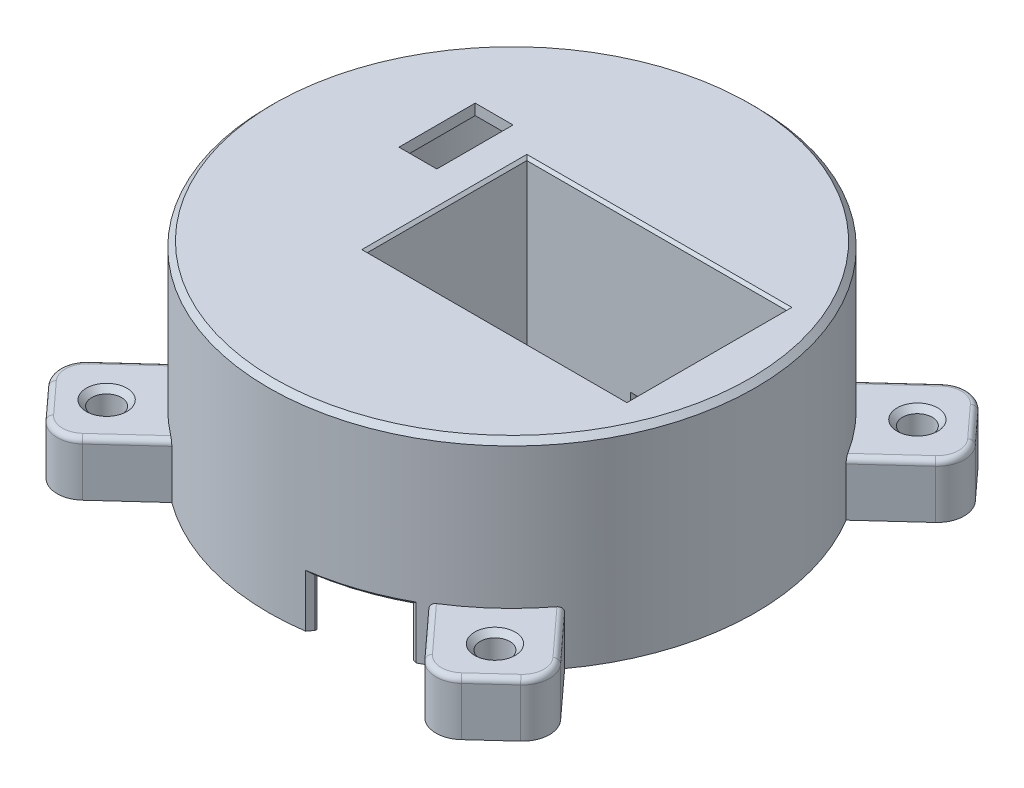
from build123d import *

# Parameters (mm, degrees)
SKETCH3_R                 = 45
BOSS_EXTRUDE1_DEPTH       = 37
SKETCH25_W                = 48
SKETCH25_H                = 29.5
CUT_EXTRUDE14_DEPTH       = 34
CUT_EXTRUDE19_DEPTH       = 73.15261603
CUT_EXTRUDE19_DEPTH_BACK  = 73.15261603
SKETCH30_R                = 1.546966385
SKETCH30_R_2              = 1.5
SKETCH42_R                = 2.75
BOSS_EXTRUDE2_DEPTH       = 10
CUT_EXTRUDE27_DEPTH       = 91.916966477
CUT_EXTRUDE27_DEPTH_BACK  = 91.916966477
SHELL3_OUTLINE_R          = 43
SHELL3_OUTLINE_W          = 52
SHELL3_OUTLINE_H          = 33.5
SHELL3_DEPTH              = 35
SHELL3_2_OUTLINE_R        = 4.75
SHELL3_2_DEPTH            = 8
SHELL3_3_OUTLINE_W        = 16.95
SHELL3_3_OUTLINE_H        = 33.5
SHELL3_3_OUTLINE_R        = 3.5
SHELL3_3_OUTLINE_W_2      = 21.15
SHELL3_3_OUTLINE_R_2      = 3.546966385
SHELL3_3_DEPTH            = 1
FILLET14_R                = 1
CUT_EXTRUDE28_OUTLINE_R   = 3.546966385
CUT_EXTRUDE28_OUTLINE_R_2 = 1.546966385
CUT_EXTRUDE28_DEPTH       = 1
CHAMFER13_START           = -1
CHAMFER13_DEPTH           = 10.7500001
FILLET18_R                = 1
FILLET20_R                = 5
FILLET21_R                = 1
CHAMFER14_SIZE            = 1
FILLET22_R                = 1
CHAMFER15_SIZE            = 0.5
SKETCH46_R                = 1.546966385
SKETCH46_R_2              = 1.5
BOSS_EXTRUDE4_DEPTH       = 1
CHAMFER16_SIZE            = 1.5
CHAMFER17_SIZE            = 1
FILLET23_R                = 1
CUT_EXTRUDE29_DEPTH       = 79.330854224
CUT_EXTRUDE29_DEPTH_BACK  = 79.330854224


with BuildPart() as part:
    # Sketch3 → Boss-Extrude1 (new body)
    with BuildSketch(Plane(origin=(0, 0, 0), x_dir=(1, 0, 0), z_dir=(0, 1, 0))):
        with Locations(Location((0, 0, 0), (0, 0, 270))):
            Circle(SKETCH3_R)
    extrude(amount=BOSS_EXTRUDE1_DEPTH)

    # Sketch25 → Cut-Extrude14 (cut)
    with BuildSketch(Plane(origin=(0, 37, 0), x_dir=(1, 0, 0), z_dir=(0, 1, 0))):
        with Locations((11.99, 0)):
            Rectangle(SKETCH25_W, SKETCH25_H)
    extrude(amount=-CUT_EXTRUDE14_DEPTH, mode=Mode.SUBTRACT)

    # Sketch30 → Cut-Extrude19 (cut, two sides: drawn at the far end of the back side and taken through both)
    with BuildSketch(Plane(origin=(0, 3, 0), x_dir=(1, 0, 0), z_dir=(0, 1, 0)).offset(-CUT_EXTRUDE19_DEPTH_BACK)):
        with Locations(Location((-7.56, 11, 0), (0, 0, 270))):
            Circle(SKETCH30_R)
        with Locations(Location((-7.56, -11, 0), (0, 0, 270))):
            Circle(SKETCH30_R)
        with Locations(Location((32.44, 11, 0), (0, 0, 270))):
            Circle(SKETCH30_R_2)
        with Locations(Location((32.44, -11, 0), (0, 0, 270))):
            Circle(SKETCH30_R_2)
    extrude(amount=CUT_EXTRUDE19_DEPTH + CUT_EXTRUDE19_DEPTH_BACK, mode=Mode.SUBTRACT)

    # Sketch42 → Boss-Extrude2 (add)
    # profile 1 of 4: a face of its own
    with BuildSketch(Plane.XZ):
        with BuildLine():
            Line((38.899023981, -47.567400455), (50.883533896, -34.447897338))
            Line((50.883533896, -34.447897338), (38.562739087, -23.192997955))
            ThreePointArc((38.562739087, -23.192997955), (33.22449062, -30.350176656), (26.578229172, -36.312501072))
            Line((26.578229172, -36.312501072), (38.899023981, -47.567400455))
        make_face()
        with Locations(Location((39.047557852, -35.89260325, 0), (0, 0, 270))):
            Circle(SKETCH42_R, mode=Mode.SUBTRACT)
    # profile 2 of 4: a face of its own
    with BuildSketch(Plane.XZ):
        with BuildLine():
            Line((-34.447897338, -50.883533896), (-23.192997955, -38.562739087))
            ThreePointArc((-23.192997955, -38.562739087), (-30.350176656, -33.22449062), (-36.312501072, -26.578229172))
            Line((-36.312501072, -26.578229172), (-47.567400455, -38.899023981))
            Line((-47.567400455, -38.899023981), (-34.447897338, -50.883533896))
        make_face()
        with Locations(Location((-35.89260325, -39.047557852, 0), (0, 0, 270))):
            Circle(SKETCH42_R, mode=Mode.SUBTRACT)
    # profile 3 of 4: a face of its own
    with BuildSketch(Plane.XZ):
        with BuildLine():
            ThreePointArc((23.192997955, 38.562739087), (30.350176656, 33.22449062), (36.312501072, 26.578229172))
            Line((36.312501072, 26.578229172), (47.567400455, 38.899023981))
            Line((47.567400455, 38.899023981), (34.447897338, 50.883533896))
            Line((34.447897338, 50.883533896), (23.192997955, 38.562739087))
        make_face()
        with Locations(Location((35.89260325, 39.047557852, 0), (0, 0, 270))):
            Circle(SKETCH42_R, mode=Mode.SUBTRACT)
    # profile 4 of 4: a face of its own
    with BuildSketch(Plane.XZ):
        with BuildLine():
            Line((-50.883533896, 34.447897338), (-38.562739087, 23.192997955))
            ThreePointArc((-38.562739087, 23.192997955), (-33.22449062, 30.350176656), (-26.578229172, 36.312501072))
            Line((-26.578229172, 36.312501072), (-38.899023981, 47.567400455))
            Line((-38.899023981, 47.567400455), (-50.883533896, 34.447897338))
        make_face()
        with Locations(Location((-39.047557852, 35.89260325, 0), (0, 0, 270))):
            Circle(SKETCH42_R, mode=Mode.SUBTRACT)
    extrude(amount=-BOSS_EXTRUDE2_DEPTH)

    # Sketch26 → Cut-Extrude27 (cut, two sides: drawn at the far end of the back side and taken through both)
    with BuildSketch(Plane.XY.offset(-14.75).offset(-CUT_EXTRUDE27_DEPTH_BACK)):
        Polygon((7.14, 3), (7.14, 9), (21.04, 9), (21.04, 3), (21.04, -1.446345943), (7.14, -1.446345943), align=None)
    extrude(amount=CUT_EXTRUDE27_DEPTH + CUT_EXTRUDE27_DEPTH_BACK, mode=Mode.SUBTRACT)

    # Shell3: read off the stored shape, not the designer's step
    # Shell3 outline → Shell3 (cut)
    with BuildSketch(Plane(origin=(0, 0, 0), x_dir=(1, 0, 0), z_dir=(0, 1, 0))):
        Circle(SHELL3_OUTLINE_R)
        with Locations((11.99, 0)):
            Rectangle(SHELL3_OUTLINE_W, SHELL3_OUTLINE_H, mode=Mode.SUBTRACT)
    extrude(amount=SHELL3_DEPTH, mode=Mode.SUBTRACT)

    # Shell3 2 outline → Shell3 2 (cut)
    # profile 1 of 4: a face of its own
    with BuildSketch(Plane(origin=(0, 0, 0), x_dir=(1, 0, 0), z_dir=(0, 1, 0))):
        with BuildLine():
            ThreePointArc((26.694921587, 33.710253062), (31.747846592, 29.001279916), (35.981638021, 23.544038))
            Line((35.981638021, 23.544038), (48.057993128, 34.575644626))
            Line((48.057993128, 34.575644626), (38.771276694, 44.741859688))
            Line((38.771276694, 44.741859688), (26.694921587, 33.710253062))
        make_face()
        with Locations((39.047557852, 35.89260325)):
            Circle(SHELL3_2_OUTLINE_R, mode=Mode.SUBTRACT)
    # profile 2 of 4: a face of its own
    with BuildSketch(Plane(origin=(0, 0, 0), x_dir=(1, 0, 0), z_dir=(0, 1, 0))):
        with BuildLine():
            Line((44.741859688, -38.771276694), (33.710253062, -26.694921587))
            ThreePointArc((33.710253062, -26.694921587), (29.001279916, -31.747846592), (23.544038, -35.981638021))
            Line((23.544038, -35.981638021), (34.575644626, -48.057993128))
            Line((34.575644626, -48.057993128), (44.741859688, -38.771276694))
        make_face()
        with Locations((35.89260325, -39.047557852)):
            Circle(SHELL3_2_OUTLINE_R, mode=Mode.SUBTRACT)
    # profile 3 of 4: a face of its own
    with BuildSketch(Plane(origin=(0, 0, 0), x_dir=(1, 0, 0), z_dir=(0, 1, 0))):
        with BuildLine():
            ThreePointArc((-33.710253062, 26.694921587), (-29.001279916, 31.747846592), (-23.544038, 35.981638021))
            Line((-23.544038, 35.981638021), (-34.575644626, 48.057993128))
            Line((-34.575644626, 48.057993128), (-44.741859688, 38.771276694))
            Line((-44.741859688, 38.771276694), (-33.710253062, 26.694921587))
        make_face()
        with Locations((-35.89260325, 39.047557852)):
            Circle(SHELL3_2_OUTLINE_R, mode=Mode.SUBTRACT)
    # profile 4 of 4: a face of its own
    with BuildSketch(Plane(origin=(0, 0, 0), x_dir=(1, 0, 0), z_dir=(0, 1, 0))):
        with BuildLine():
            Line((-38.771276694, -44.741859688), (-26.694921587, -33.710253062))
            ThreePointArc((-26.694921587, -33.710253062), (-31.747846592, -29.001279916), (-35.981638021, -23.544038))
            Line((-35.981638021, -23.544038), (-48.057993128, -34.575644626))
            Line((-48.057993128, -34.575644626), (-38.771276694, -44.741859688))
        make_face()
        with Locations((-39.047557852, -35.89260325)):
            Circle(SHELL3_2_OUTLINE_R, mode=Mode.SUBTRACT)
    extrude(amount=SHELL3_2_DEPTH, mode=Mode.SUBTRACT)

    # Shell3 3 outline → Shell3 3 (cut)
    # profile 1 of 2: a face of its own
    with BuildSketch(Plane(origin=(0, 0, 0), x_dir=(1, 0, 0), z_dir=(0, 1, 0))):
        with Locations((29.515, 0)):
            Rectangle(SHELL3_3_OUTLINE_W, SHELL3_3_OUTLINE_H)
        with Locations((32.44, -11)):
            Circle(SHELL3_3_OUTLINE_R, mode=Mode.SUBTRACT)
        with Locations((32.44, 11)):
            Circle(SHELL3_3_OUTLINE_R, mode=Mode.SUBTRACT)
    # profile 2 of 2: a face of its own
    with BuildSketch(Plane(origin=(0, 0, 0), x_dir=(1, 0, 0), z_dir=(0, 1, 0))):
        with Locations((-3.435, 0)):
            Rectangle(SHELL3_3_OUTLINE_W_2, SHELL3_3_OUTLINE_H)
        with Locations((-7.56, -11)):
            Circle(SHELL3_3_OUTLINE_R_2, mode=Mode.SUBTRACT)
        with Locations((-7.56, 11)):
            Circle(SHELL3_3_OUTLINE_R_2, mode=Mode.SUBTRACT)
    extrude(amount=SHELL3_3_DEPTH, mode=Mode.SUBTRACT)

    # Fillet14
    fillet14_edges = [part.edges().sort_by_distance(p)[0] for p in [
        (37.99, 18, -16.75),
        (11.99, 35, -16.75),
        (-14.01, 18, 16.75),
        (11.99, 35, 16.75),
        (37.99, 35, 0),
        (37.99, 18, 16.75),
        (-14.01, 35, 0),
        (-14.01, 18, -16.75),
        (14.09, 9, 16.75),
        (14.09, 9, -16.75),
        (21.04, 5, 16.75),
        (21.04, 5, -16.75),
        (7.14, 5, -16.75),
        (7.14, 5, 16.75),
    ]]
    fillet(fillet14_edges, radius=FILLET14_R)

    # Cut-Extrude28: read off the stored shape, not the designer's step
    # Cut-Extrude28 outline → Cut-Extrude28 (cut)
    # profile 1 of 2: a face of its own
    with BuildSketch(Plane.XZ.offset(-1)):
        with Locations((-7.56, -11)):
            Circle(CUT_EXTRUDE28_OUTLINE_R)
        with Locations((-7.56, -11)):
            Circle(CUT_EXTRUDE28_OUTLINE_R_2, mode=Mode.SUBTRACT)
    # profile 2 of 2: a face of its own
    with BuildSketch(Plane.XZ.offset(-1)):
        with Locations((-7.56, 11)):
            Circle(CUT_EXTRUDE28_OUTLINE_R)
        with Locations((-7.56, 11)):
            Circle(CUT_EXTRUDE28_OUTLINE_R_2, mode=Mode.SUBTRACT)
    extrude(amount=CUT_EXTRUDE28_DEPTH, mode=Mode.SUBTRACT)

    # Chamfer13: read off the stored shape, not the designer's step
    # Chamfer13 outline → Chamfer13 (cut)
    with BuildSketch(Plane(origin=(0, 0, 0), x_dir=(1, 0, 0), z_dir=(0, 1, 0)).offset(CHAMFER13_START)):
        with BuildLine():
            Line((6.493764385, -42.506835028), (7.14, -43.153070644))
            Line((7.14, -43.153070644), (7.14, -43.524879746))
            Line((7.14, -43.524879746), (6.404595784, -44.541903337))
            ThreePointArc((6.404595784, -44.541903337), (14.280665495, -42.67390998), (21.69466313, -39.425139083))
            Line((21.69466313, -39.425139083), (21.04, -39.223434924))
            Line((21.04, -39.223434924), (21.04, -38.250911989))
            Line((21.04, -38.250911989), (22.889204158, -36.401707831))
            ThreePointArc((22.889204158, -36.401707831), (15.005260898, -40.296924763), (6.493764385, -42.506835028))
        make_face()
        with BuildLine():
            Line((7.14, 43.153070644), (6.493764385, 42.506835028))
            ThreePointArc((6.493764385, 42.506835028), (15.005260898, 40.296924763), (22.889204158, 36.401707831))
            Line((22.889204158, 36.401707831), (21.04, 38.250911989))
            Line((21.04, 38.250911989), (21.04, 39.223434924))
            Line((21.04, 39.223434924), (21.69466313, 39.425139083))
            ThreePointArc((21.69466313, 39.425139083), (14.280665495, 42.67390998), (6.404595784, 44.541903337))
            Line((6.404595784, 44.541903337), (7.14, 43.524879746))
            Line((7.14, 43.524879746), (7.14, 43.153070644))
        make_face()
    extrude(amount=CHAMFER13_DEPTH, mode=Mode.SUBTRACT)

    # Chamfer13 2 outline → Chamfer13 2 (revolve)
    with BuildSketch(Plane.XY):
        Polygon((43, 9.75), (43.75, 9), (44.25, 9), (45, 9.75), align=None)
    revolve(axis=Axis((0, 0, 0), (0, 1, 0)))

    # Fillet18
    fillet18_edges = [part.edges().sort_by_distance(p)[0] for p in [
        (7.14, 3, 0),
        (21.04, 3, 0),
    ]]
    fillet(fillet18_edges, radius=FILLET18_R)

    # Fillet20
    fillet20_edges = [part.edges().sort_by_distance(p)[0] for p in [
        (38.899023981, 5, -47.567400455),
        (50.883533896, 5, -34.447897338),
        (34.447897338, 5, 50.883533896),
        (47.567400455, 5, 38.899023981),
        (-50.883533896, 5, 34.447897338),
        (-38.899023981, 5, 47.567400455),
        (-34.447897338, 5, -50.883533896),
        (-47.567400455, 5, -38.899023981),
    ]]
    fillet(fillet20_edges, radius=FILLET20_R)

    # Fillet21
    fillet21_edges = [part.edges().sort_by_distance(p)[0] for p in [
        (40.253829838, 10, 30.892821542),
        (41.007648897, 10, 44.891278938),
        (27.134326721, 10, 42.877331457),
        (34.541438124, 10, 48.81457957),
        (45.49844613, 10, 38.805483195),
        (-30.892821542, 10, 40.253829838),
        (-44.891278938, 10, 41.007648897),
        (-42.877331457, 10, 27.134326721),
        (-48.81457957, 10, 34.541438124),
        (-38.805483195, 10, 45.49844613),
        (-40.253829838, 10, -30.892821542),
        (-41.007648897, 10, -44.891278938),
        (-27.134326721, 10, -42.877331457),
        (-34.541438124, 10, -48.81457957),
        (-45.49844613, 10, -38.805483195),
        (44.891278938, 10, -41.007648897),
        (42.877331457, 10, -27.134326721),
        (30.892821542, 10, -40.253829838),
        (38.805483195, 10, -45.49844613),
        (48.81457957, 10, -34.541438124),
    ]]
    fillet(fillet21_edges, radius=FILLET21_R)

    # Chamfer14
    chamfer14_edges = [part.edges().sort_by_distance(p)[0] for p in [
        (39.047557852, 10, -33.14260325),
        (35.89260325, 10, 41.797557852),
        (-39.047557852, 10, 38.64260325),
        (-35.89260325, 10, -36.297557852),
    ]]
    chamfer(chamfer14_edges, length=CHAMFER14_SIZE)

    # Fillet22
    fillet22_edges = [part.edges().sort_by_distance(p)[0] for p in [
        (31.747846592, 8, -29.001279916),
        (29.001279916, 8, 31.747846592),
        (-31.747846592, 8, 29.001279916),
        (-29.001279916, 8, -31.747846592),
    ]]
    fillet(fillet22_edges, radius=FILLET22_R)

    # Chamfer15
    chamfer15_edges = [part.edges().sort_by_distance(p)[0] for p in [
        (11.99, 37, 14.75),
        (35.99, 37, 0),
        (11.99, 37, -14.75),
        (-12.01, 37, 0),
    ]]
    chamfer(chamfer15_edges, length=CHAMFER15_SIZE)

    # Sketch46 → Boss-Extrude4 (add)
    # profile 1 of 2: a face of its own
    with BuildSketch(Plane.XZ.offset(-1)):
        with BuildLine():
            Line((-13.01, -16.75), (6.14, -16.75))
            ThreePointArc((6.14, -16.75), (6.847106781, -16.457106781), (7.14, -15.75))
            Line((7.14, -15.75), (7.14, 15.75))
            ThreePointArc((7.14, 15.75), (6.847106781, 16.457106781), (6.14, 16.75))
            Line((6.14, 16.75), (-13.01, 16.75))
            ThreePointArc((-13.01, 16.75), (-13.717106781, 16.457106781), (-14.01, 15.75))
            Line((-14.01, 15.75), (-14.01, -15.75))
            ThreePointArc((-14.01, -15.75), (-13.717106781, -16.457106781), (-13.01, -16.75))
        make_face()
        with Locations(Location((-7.56, 11, 0), (0, 0, 90))):
            Circle(SKETCH46_R, mode=Mode.SUBTRACT)
        with Locations(Location((-7.56, -11, 0), (0, 0, 90))):
            Circle(SKETCH46_R, mode=Mode.SUBTRACT)
    # profile 2 of 2: a face of its own
    with BuildSketch(Plane.XZ.offset(-1)):
        with BuildLine():
            Line((21.04, 15.75), (21.04, -15.75))
            ThreePointArc((21.04, -15.75), (21.332893219, -16.457106781), (22.04, -16.75))
            Line((22.04, -16.75), (36.99, -16.75))
            ThreePointArc((36.99, -16.75), (37.697106781, -16.457106781), (37.99, -15.75))
            Line((37.99, -15.75), (37.99, 15.75))
            ThreePointArc((37.99, 15.75), (37.697106781, 16.457106781), (36.99, 16.75))
            Line((36.99, 16.75), (22.04, 16.75))
            ThreePointArc((22.04, 16.75), (21.332893219, 16.457106781), (21.04, 15.75))
        make_face()
        with Locations(Location((32.44, 11, 0), (0, 0, 90))):
            Circle(SKETCH46_R_2, mode=Mode.SUBTRACT)
        with Locations(Location((32.44, -11, 0), (0, 0, 90))):
            Circle(SKETCH46_R_2, mode=Mode.SUBTRACT)
    extrude(amount=BOSS_EXTRUDE4_DEPTH)

    # Chamfer16
    chamfer16_edges = [part.edges().sort_by_distance(p)[0] for p in [
        (32.44, 0, 9.5),
        (32.44, 0, -12.5),
        (-7.56, 0, 9.453033615),
        (-7.56, 0, -12.546966385),
    ]]
    chamfer(chamfer16_edges, length=CHAMFER16_SIZE)

    # Chamfer17
    chamfer17_edges = [part.edges().sort_by_distance(p)[0] for p in [
        (0, 37, -45),
    ]]
    chamfer(chamfer17_edges, length=CHAMFER17_SIZE)

    # Fillet23
    fillet23_edges = [part.edges().sort_by_distance(p)[0] for p in [
        (-13.717106781, 0, -16.457106781),
        (-3.435, 0, -16.75),
        (6.847106781, 0, -16.457106781),
        (7.14, 0, 0),
        (6.847106781, 0, 16.457106781),
        (-3.435, 0, 16.75),
        (-13.717106781, 0, 16.457106781),
        (-14.01, 0, 0),
        (21.332893219, 0, 16.457106781),
        (21.04, 0, 0),
        (21.332893219, 0, -16.457106781),
        (29.515, 0, -16.75),
        (37.697106781, 0, -16.457106781),
        (37.99, 0, 0),
        (37.697106781, 0, 16.457106781),
        (29.515, 0, 16.75),
    ]]
    fillet(fillet23_edges, radius=FILLET23_R)

    # Sketch47 → Cut-Extrude29 (cut, two sides: drawn at the far end of the back side and taken through both)
    with BuildSketch(Plane(origin=(0, 37, 0), x_dir=(1, 0, 0), z_dir=(0, 1, 0)).offset(-CUT_EXTRUDE29_DEPTH_BACK)):
        Polygon((-25.48586, 11.635201679), (-25.48586, 4.585201679), (-18.48586, 4.585201679), (-18.48586, 18.685201679), (-25.48586, 18.685201679), align=None)
    extrude(amount=CUT_EXTRUDE29_DEPTH + CUT_EXTRUDE29_DEPTH_BACK, mode=Mode.SUBTRACT)


solid = part.part
